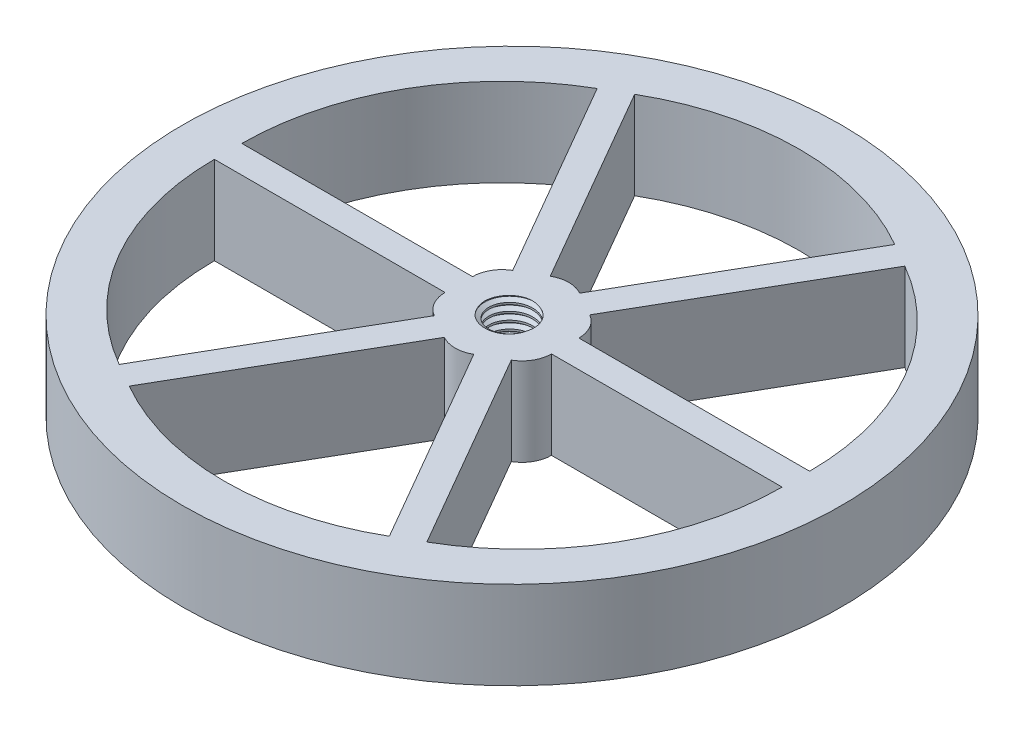
from build123d import *

# Parameters (mm, degrees)
SKETCH1_R           = 30
SKETCH1_R_2         = 2
BOSS_EXTRUDE1_DEPTH = 8
THREAD1_PITCH       = 0.7


with BuildPart() as part:
    # Sketch1 → Boss-Extrude1 (new body)
    with BuildSketch(Plane(origin=(0, 0, 0), x_dir=(1, 0, 0), z_dir=(0, 1, 0))):
        with Locations(Location((0, 0, 0), (0, 0, 270))):
            Circle(SKETCH1_R)
        with Locations(Location((0, 0, 0), (0, 0, 270))):
            Circle(SKETCH1_R_2, mode=Mode.SUBTRACT)
        with BuildLine():
            Line((4.841229183, 1.25), (25.841229183, 1.25))
            ThreePointArc((25.841229183, 1.25), (22.669224447, 13.088082837), (14.003146346, 21.754160937))
            Line((14.003146346, 21.754160937), (3.503146346, 3.567627458))
            ThreePointArc((3.503146346, 3.567627458), (4.482690967, 2.588082837), (4.841229183, 1.25))
        make_face(mode=Mode.SUBTRACT)
        with BuildLine():
            Line((4.841229183, -1.25), (25.841229183, -1.25))
            ThreePointArc((25.841229183, -1.25), (22.669224447, -13.088082837), (14.003146346, -21.754160937))
            Line((14.003146346, -21.754160937), (3.503146346, -3.567627458))
            ThreePointArc((3.503146346, -3.567627458), (4.482690967, -2.588082837), (4.841229183, -1.25))
        make_face(mode=Mode.SUBTRACT)
        with BuildLine():
            Line((-1.338082837, 4.817627458), (-11.838082837, 23.004160937))
            ThreePointArc((-11.838082837, 23.004160937), (0, 26.176165673), (11.838082837, 23.004160937))
            Line((11.838082837, 23.004160937), (1.338082837, 4.817627458))
            ThreePointArc((1.338082837, 4.817627458), (0, 5.176165673), (-1.338082837, 4.817627458))
        make_face(mode=Mode.SUBTRACT)
        with BuildLine():
            Line((-3.503146346, 3.567627458), (-14.003146346, 21.754160937))
            ThreePointArc((-14.003146346, 21.754160937), (-22.669224447, 13.088082837), (-25.841229183, 1.25))
            Line((-25.841229183, 1.25), (-4.841229183, 1.25))
            ThreePointArc((-4.841229183, 1.25), (-4.482690967, 2.588082837), (-3.503146346, 3.567627458))
        make_face(mode=Mode.SUBTRACT)
        with BuildLine():
            Line((-4.841229183, -1.25), (-25.841229183, -1.25))
            ThreePointArc((-25.841229183, -1.25), (-22.669224447, -13.088082837), (-14.003146346, -21.754160937))
            Line((-14.003146346, -21.754160937), (-3.503146346, -3.567627458))
            ThreePointArc((-3.503146346, -3.567627458), (-4.482690967, -2.588082837), (-4.841229183, -1.25))
        make_face(mode=Mode.SUBTRACT)
        with BuildLine():
            Line((1.338082837, -4.817627458), (11.838082837, -23.004160937))
            ThreePointArc((11.838082837, -23.004160937), (0, -26.176165673), (-11.838082837, -23.004160937))
            Line((-11.838082837, -23.004160937), (-1.338082837, -4.817627458))
            ThreePointArc((-1.338082837, -4.817627458), (0, -5.176165673), (1.338082837, -4.817627458))
        make_face(mode=Mode.SUBTRACT)
    extrude(amount=BOSS_EXTRUDE1_DEPTH)

    # Thread1: the profile of Thread Profile1 profile screwed along a right-hand helix of 13.728571 turns, 6 arcs to a turn; built about Z, then put on its axis
    thread1_z = Axis((0, 0, 0), (0, 0, 1))
    thread1_corners = [(1.9997, 0, -0.000173205), (2.378886113, 0, 0.218749999), (2.378886113, 0, 0.306249999), (1.9997, 0, 0.525173203)]
    with BuildLine(mode=Mode.PRIVATE) as thread1_profile:
        Line(thread1_corners[0], thread1_corners[1])
        Line(thread1_corners[1], thread1_corners[2])
        Line(thread1_corners[2], thread1_corners[3])
        Line(thread1_corners[3], thread1_corners[0])
    thread1_cap = Face(thread1_profile.wire())
    thread1_turn_angles = [0, 30, 60, 90, 120, 150, 180, 210, 240, 270, 300, 330, 360]
    thread1_turn_weights = [1, 0.8660254037844387, 1, 0.8660254037844387, 1, 0.8660254037844387, 1, 0.8660254037844387, 1, 0.8660254037844387, 1, 0.8660254037844387, 1]
    thread1_turn_rails = [Edge.make_bspline([Vector(p[0], p[1], 0).rotate(thread1_z, thread1_turn_angles[k]) / thread1_turn_weights[k] + Vector(0, 0, p[2] + THREAD1_PITCH * thread1_turn_angles[k] / 360) for k in range(13)], [0, 0, 0, 1, 1, 2, 2, 3, 3, 4, 4, 5, 5, 6, 6, 6], 2, thread1_turn_weights) for p in thread1_corners]
    thread1_turn_sides = [Face.make_surface_from_curves(thread1_turn_rails[p[0]], thread1_turn_rails[p[1]]) for p in [(0, 1), (1, 2), (2, 3), (3, 0)]]
    thread1_last_angles = [4680, 4710, 4740, 4770, 4800, 4830, 4860, 4890, 4920, 4931.142857143, 4942.285714286]
    thread1_last_weights = [1, 0.8660254037844387, 1, 0.8660254037844387, 1, 0.8660254037844387, 1, 0.8660254037844387, 1, 0.981148383394172, 1]
    thread1_last_rails = [Edge.make_bspline([Vector(p[0], p[1], 0).rotate(thread1_z, thread1_last_angles[k]) / thread1_last_weights[k] + Vector(0, 0, p[2] + THREAD1_PITCH * thread1_last_angles[k] / 360) for k in range(11)], [0, 0, 0, 1, 1, 2, 2, 3, 3, 4, 4, 5, 5, 5], 2, thread1_last_weights) for p in thread1_corners]
    thread1_last_sides = [Face.make_surface_from_curves(thread1_last_rails[p[0]], thread1_last_rails[p[1]]) for p in [(0, 1), (1, 2), (2, 3), (3, 0)]]
    thread1 = Plane(origin=(0, 9.61, 0), x_dir=(-1, 0, 0), z_dir=(0, -1, 0)) * Solid(Shell([*[p.moved(Location((0, 0, THREAD1_PITCH * i))) for i in range(13) for p in thread1_turn_sides], *thread1_last_sides, thread1_cap, thread1_cap.rotate(thread1_z, 4942.285714286).moved(Location((0, 0, THREAD1_PITCH * 4942.285714286 / 360)))]))
    add(thread1, mode=Mode.SUBTRACT)


solid = part.part
